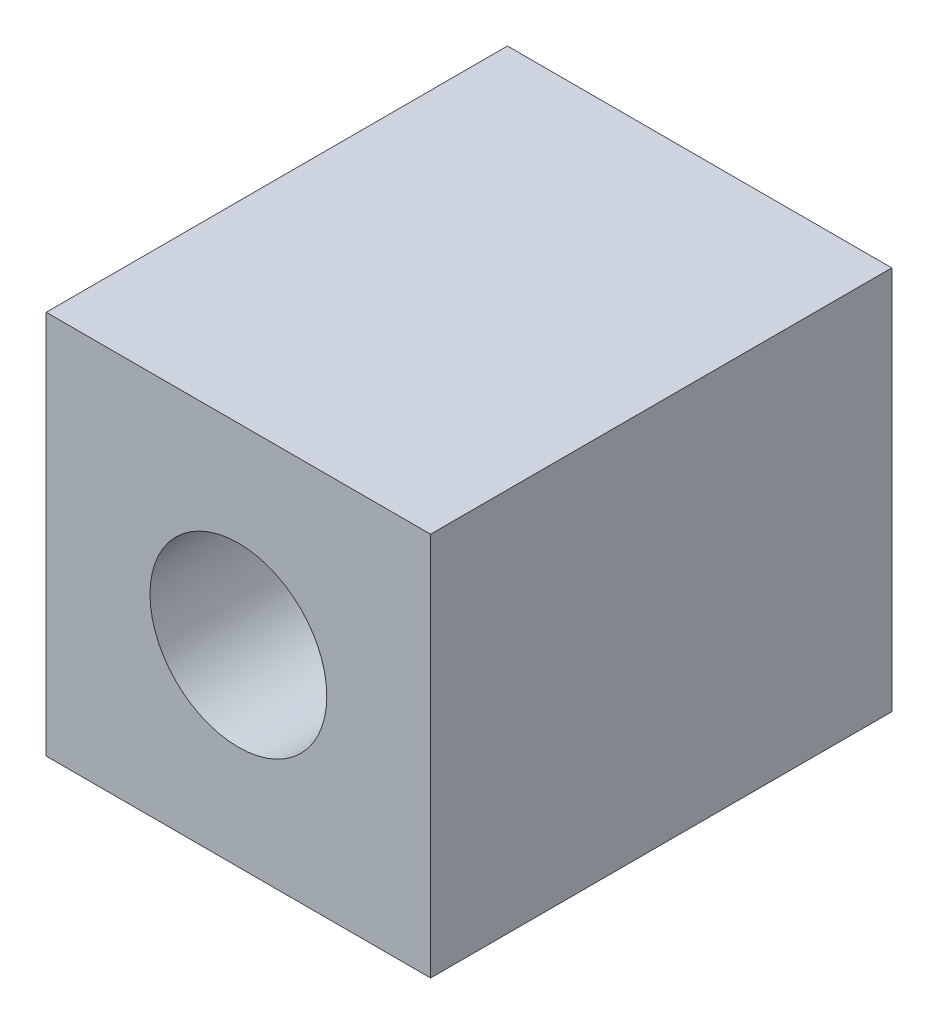
from build123d import *

# Parameters (mm, degrees)
SKETCH_1_W          = 5
SKETCH_1_H          = 5
EXTRUDE_1_DEPTH     = 6
SKETCH_2_R          = 1.15
CUT_EXTRUDE_1_DEPTH = 8.217444695


with BuildPart() as part:
    # ｽｹｯﾁ1 → ﾎﾞｽ - 押し出し1 (new body)
    with BuildSketch(Plane.XY):
        with Locations((-0.278845647, 0.3930131)):
            Rectangle(SKETCH_1_W, SKETCH_1_H)
    extrude(amount=EXTRUDE_1_DEPTH)

    # ｽｹｯﾁ2 → ｶｯﾄ - 押し出し1 (cut, through all)
    with BuildSketch(Plane.XY.offset(6)):
        with Locations((-0.278845647, 0.3930131)):
            Circle(SKETCH_2_R)
    extrude(amount=-CUT_EXTRUDE_1_DEPTH, mode=Mode.SUBTRACT)


solid = part.part
